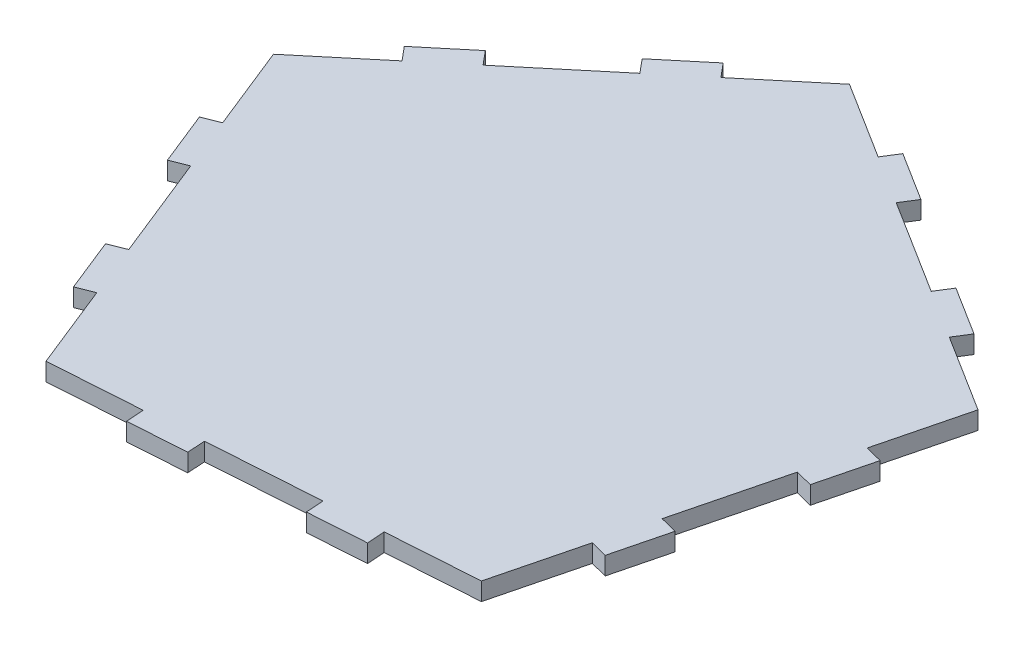
from build123d import *

# Parameters (mm, degrees)
BOSS_EXTRUDE1_DEPTH = 3.18
MALE_CUT_DEPTH      = 10
CIRPATTERN2_COUNT   = 5


with BuildPart() as part:
    # Sketch1 → Boss-Extrude1 (new body)
    with BuildSketch(Plane(origin=(0, 0, 0), x_dir=(1, 0, 0), z_dir=(0, 1, 0))):
        Polygon((-63.737105075, 16.079573621), (-34.988431912, -55.6487276), (42.113064941, -50.472378708), (61.015737415, 24.455082065), (-4.403265369, 65.586450623), align=None)
    extrude(amount=BOSS_EXTRUDE1_DEPTH)

    # Sketch3 → Male Cut (cut)
    with BuildSketch(Plane(origin=(0, 3.18, 0), x_dir=(1, 0, 0), z_dir=(0, 1, 0))):
        Polygon((-47.473883695, 25.50769427), (-49.511175703, 27.949382471), (-63.737105075, 16.079573621), (-62.493165655, 12.975929119), align=None)
        Polygon((-26.476381351, 47.169118399), (-41.663989094, 34.496905844), (-39.626697085, 32.055217643), (-24.439089342, 44.727430198), align=None)
        Polygon((-4.403265369, 65.586450623), (-18.629194741, 53.716641772), (-16.591902733, 51.274953571), (-1.572620772, 63.806718722), align=None)
    male_cut = extrude(amount=-MALE_CUT_DEPTH, mode=Mode.SUBTRACT)

    # CirPattern2: Male Cut ×5 about axis
    cirpattern2_axis = Axis((0, 3.339, 0), (0, -1, 0))
    for i in range(1, CIRPATTERN2_COUNT):
        add(male_cut.rotate(cirpattern2_axis, i * 360 / CIRPATTERN2_COUNT), mode=Mode.SUBTRACT)


solid = part.part
